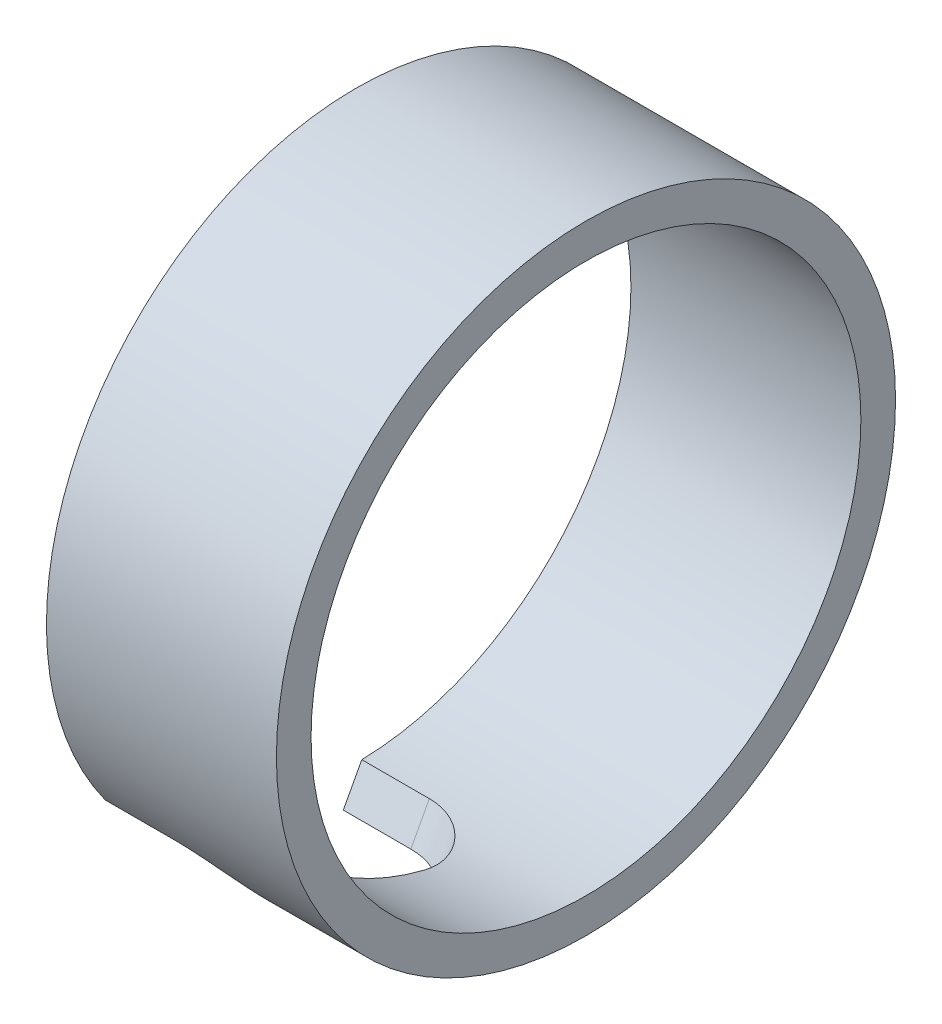
from build123d import *

# Parameters (mm, degrees)
SKETCH1_W          = 6.485999982
SKETCH1_H          = 0.977250014
CUT_EXTRUDE1_REACH = 42.92


with BuildPart() as part:
    # Sketch1 → Revolve1 (revolve)
    with BuildSketch(Plane.XY):
        with Locations((-35.769999961, 8.242624993)):
            Rectangle(SKETCH1_W, SKETCH1_H)
    revolve(axis=Axis((0, 0, 0), (-1, 0, 0)))

    # Sketch3 → Cut-Extrude1 (cut, up to next)
    with BuildSketch(Plane(origin=(0, 0, 0), x_dir=(1, 0, 0), z_dir=(0, -0.8810924150750458, 0.4729441363387683)), mode=Mode.PRIVATE) as cut_extrude1_sk1:
        with BuildLine():
            Line((-39.012999952, 3.81), (-39.012999952, -3.81))
            Line((-39.012999952, -3.81), (-37.107999952, -3.81))
            ThreePointArc((-37.107999952, -3.81), (-35.760961534, -3.252038418), (-35.202999952, -1.905))
            Line((-35.202999952, -1.905), (-35.202999952, 1.905))
            ThreePointArc((-35.202999952, 1.905), (-35.760961534, 3.252038418), (-37.107999952, 3.81))
            Line((-37.107999952, 3.81), (-39.012999952, 3.81))
        make_face()
    cut_extrude1_tool1 = extrude(cut_extrude1_sk1.sketch, amount=CUT_EXTRUDE1_REACH, mode=Mode.PRIVATE) & part.part
    add(cut_extrude1_tool1.solids().sort_by_distance((-37.191875, 0, 0))[0], mode=Mode.SUBTRACT)


solid = part.part
